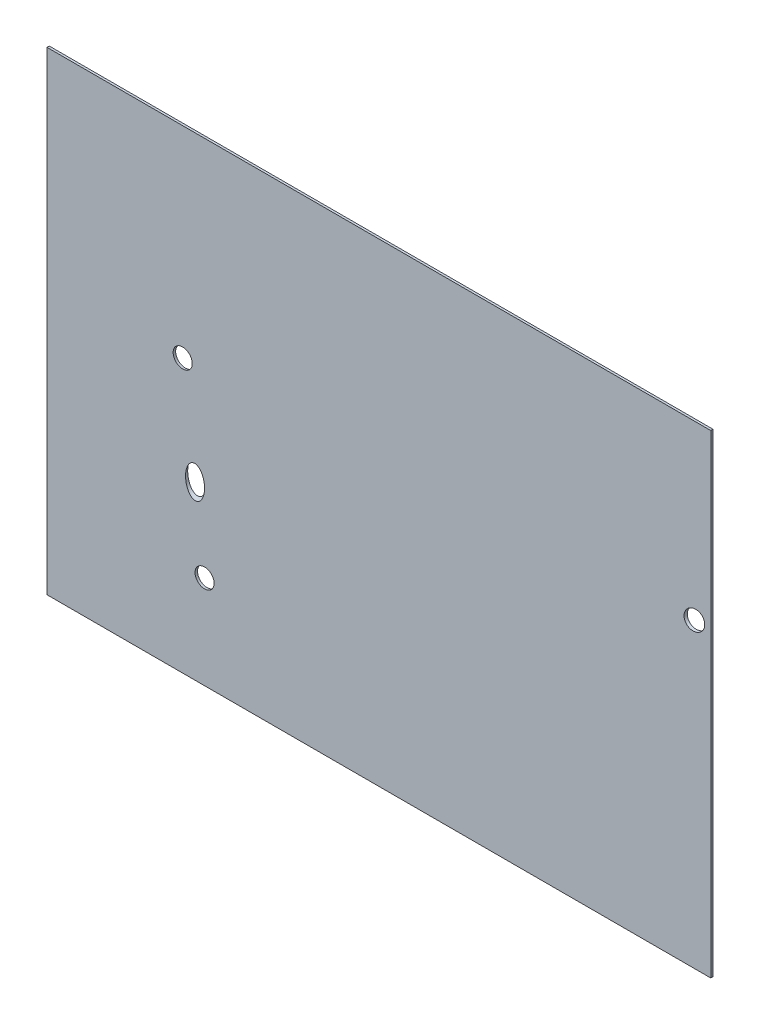
from build123d import *

# Parameters (mm, degrees)
SKETCH1_W           = 889
SKETCH1_H           = 635
BOSS_EXTRUDE1_DEPTH = 3
CAVITY1_START       = -39.73878613
CAVITY1_OUTLINE_R   = 12.7
CAVITY1_DEPTH       = 6.162318367
CAVITY1_START_2     = 95.028980994
CAVITY1_2_OUTLINE_R = 12.7
CAVITY1_2_DEPTH     = 39.622761672
CAVITY1_START_3     = -38.131795138
CAVITY1_3_OUTLINE_R = 12.7
CAVITY1_3_DEPTH     = 6.816543719
CAVITY1_START_4     = 156.456430578
CAVITY1_4_OUTLINE_R = 12.7
CAVITY1_4_DEPTH     = 17.482665183


# Read off the part's stored shape, not the designer's step: Cavity1
with BuildPart() as part:
    # Sketch1 → Boss-Extrude1 (new body)
    with BuildSketch(Plane.XY):
        with Locations((0, -63.5)):
            Rectangle(SKETCH1_W, SKETCH1_H)
    extrude(amount=BOSS_EXTRUDE1_DEPTH)

    # Cavity1 outline → Cavity1 (cut)
    with BuildSketch(Plane(origin=(0, 0, 0), x_dir=(0.9928632383141258, -0.0034499735487700917, 0.1192085889812489), z_dir=(0.11925850076362501, 0.028722077569289003, -0.9924477075673641)).offset(CAVITY1_START)):
        with Locations((-230.540732361, 255.745504345)):
            Circle(CAVITY1_OUTLINE_R)
    extrude(amount=CAVITY1_DEPTH, mode=Mode.SUBTRACT)

    # Cavity1 2 outline → Cavity1 2 (cut)
    with BuildSketch(Plane(origin=(0, 0, 0), x_dir=(0.9996900907049888, 0.020055402042160962, -0.014747996310634162), z_dir=(0.024894227167180604, -0.8053749390173811, 0.5922427585513381)).offset(CAVITY1_START_2)):
        with Locations((-249.218164977, -87.123506937)):
            Circle(CAVITY1_2_OUTLINE_R)
    extrude(amount=CAVITY1_2_DEPTH, mode=Mode.SUBTRACT)

    # Cavity1 3 outline → Cavity1 3 (cut)
    with BuildSketch(Plane(origin=(0, 0, 0), x_dir=(0.991429466218815, 0.00897431187314574, 0.13033447448575944), z_dir=(0.1306430767896851, -0.06810462099264145, -0.9890875325704865)).offset(CAVITY1_START_3)):
        with Locations((-260.24847135, 15.645526602)):
            Circle(CAVITY1_3_OUTLINE_R)
    extrude(amount=CAVITY1_3_DEPTH, mode=Mode.SUBTRACT)

    # Cavity1 4 outline → Cavity1 4 (cut)
    with BuildSketch(Plane(origin=(0, 0, 0), x_dir=(0.9264565352650909, -0.12370811638942411, 0.3554920395789254), z_dir=(0.3764017644281221, 0.30448898949357206, -0.8749903810971752)).offset(CAVITY1_START_4)):
        with Locations((389.706990351, -22.846486416)):
            Circle(CAVITY1_4_OUTLINE_R)
    extrude(amount=CAVITY1_4_DEPTH, mode=Mode.SUBTRACT)


solid = part.part
